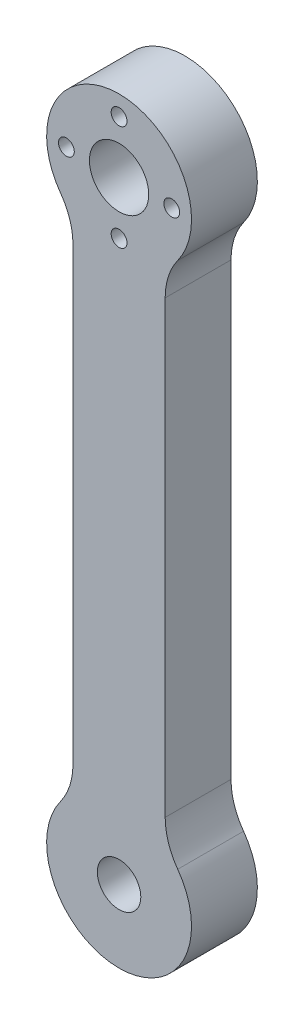
from build123d import *

# Parameters (mm, degrees)
ESQUISSE1_R        = 4.502635458
BOSS_EXTRU_1_DEPTH = 10
D_GAGEMENT_M21_D   = 2.4
CONG_1_R           = 10
D_GAGEMENT_M61_D   = 6.6


with BuildPart() as part:
    # Esquisse1 → Boss.-Extru.1 (new body)
    with BuildSketch(Plane.XY):
        with BuildLine():
            Line((-7, 38), (-7, -38))
            ThreePointArc((-7, -38), (0, -57.485281374), (7, -38))
            Line((7, -38), (7, 38))
            ThreePointArc((7, 38), (0, 57.485281374), (-7, 38))
        make_face()
        with Locations((0, 46.485281374)):
            Circle(ESQUISSE1_R, mode=Mode.SUBTRACT)
    extrude(amount=BOSS_EXTRU_1_DEPTH)

    # Dégagement M21 (through all)
    with Locations(Plane.XY.offset(10)):
        with Locations((-8, 46.485281374), (0, 54.485281374), (8, 46.485281374), (0, 38.485281374)):
            Hole(D_GAGEMENT_M21_D / 2)

    # Congé1
    cong_1_edges = [part.edges().sort_by_distance(p)[0] for p in [
        (-7, -38, 5),
        (7, -38, 5),
        (7, 38, 5),
        (-7, 38, 5),
    ]]
    fillet(cong_1_edges, radius=CONG_1_R)

    # Dégagement M61 (through all)
    with Locations(Plane.XY.offset(10)):
        with Locations((0, -46.485281374)):
            Hole(D_GAGEMENT_M61_D / 2)


solid = part.part
